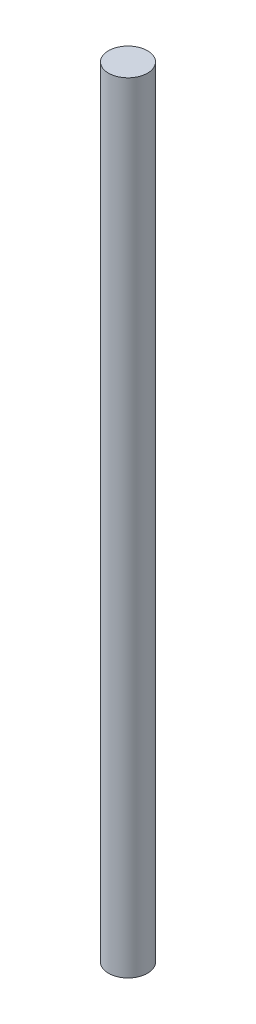
from build123d import *

# Parameters (mm, degrees)
SKETCH1_R           = 3
BOSS_EXTRUDE1_DEPTH = 120


with BuildPart() as part:
    # Sketch1 → Boss-Extrude1 (new body)
    with BuildSketch(Plane(origin=(0, 0, 0), x_dir=(1, 0, 0), z_dir=(0, 1, 0))):
        Circle(SKETCH1_R)
    extrude(amount=BOSS_EXTRUDE1_DEPTH)


solid = part.part
